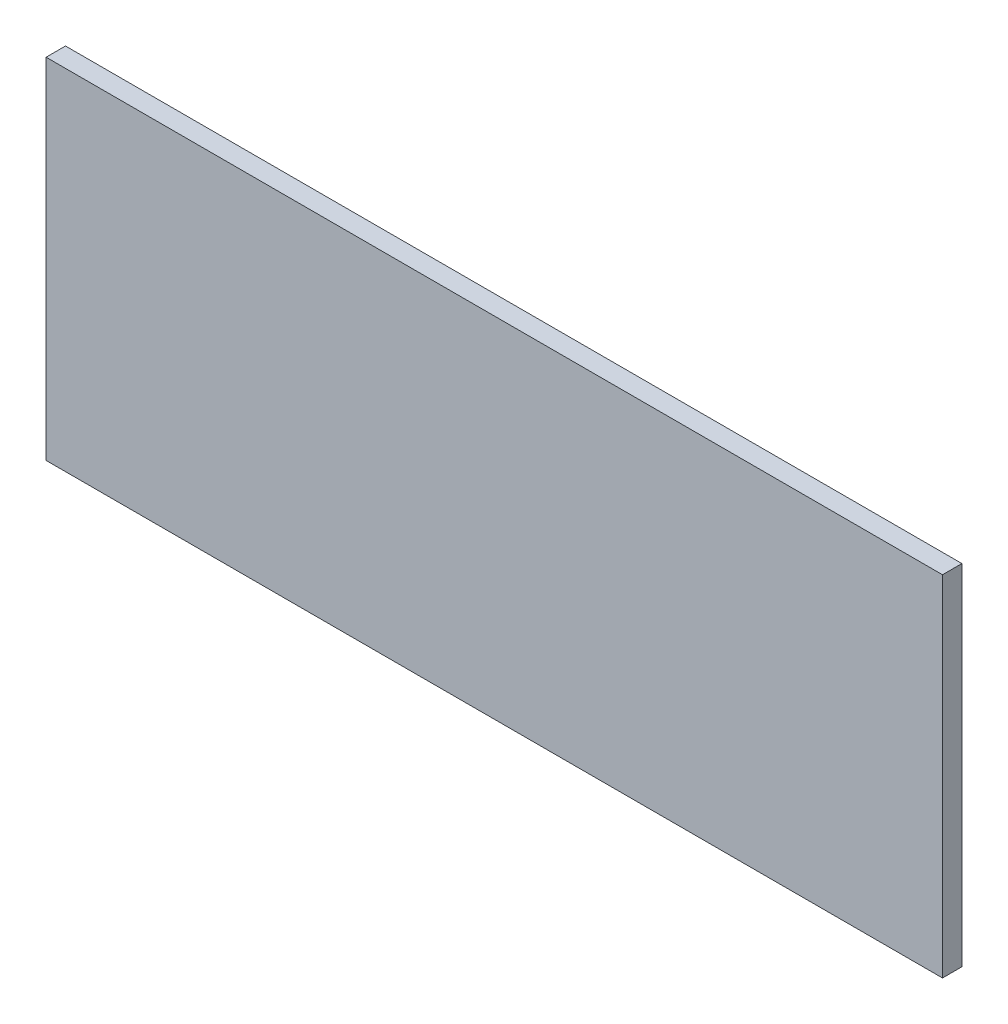
from build123d import *

# Parameters (mm, degrees)
SKETCH1_W           = 231
SKETCH1_H           = 90
BOSS_EXTRUDE1_DEPTH = 5


with BuildPart() as part:
    # Sketch1 → Boss-Extrude1 (new body)
    with BuildSketch(Plane.XY):
        Rectangle(SKETCH1_W, SKETCH1_H)
    extrude(amount=BOSS_EXTRUDE1_DEPTH)


solid = part.part
